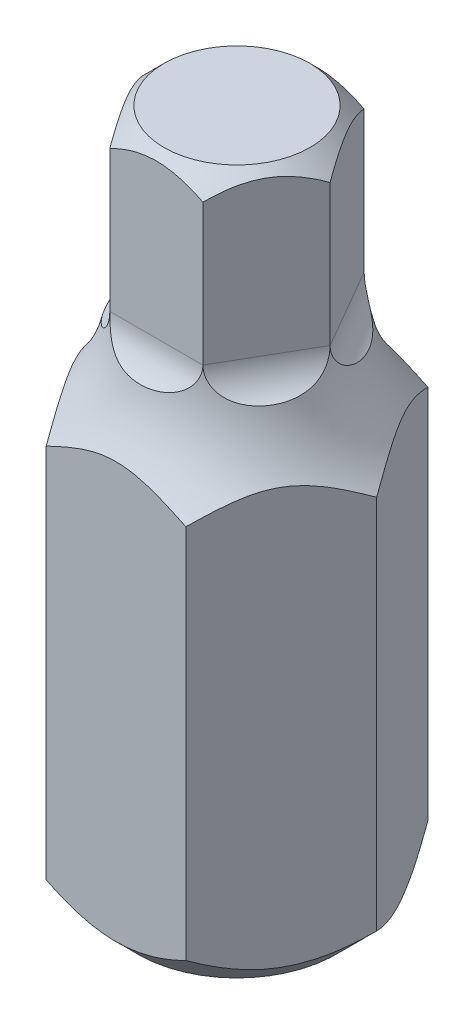
from build123d import *

# Parameters (mm, degrees)
BOSS_EXTRUDE1_DEPTH = 17
SKETCH2_OUTSIDE_W   = 12.79
SKETCH2_OUTSIDE_H   = 11.862
CUT_EXTRUDE1_DEPTH  = 5
FILLET4_R           = 1
SKETCH5_R           = 3.693225834


with BuildPart() as part:
    # Sketch1 → Boss-Extrude1 (new body)
    with BuildSketch(Plane(origin=(0, 0, 0), x_dir=(1, 0, 0), z_dir=(0, 1, 0))):
        Polygon((3.464101615, 0), (1.732050808, 3), (-1.732050808, 3), (-3.464101615, 0), (-1.732050808, -3), (1.732050808, -3), align=None)
    extrude(amount=-BOSS_EXTRUDE1_DEPTH)

    # Sketch2 outside → Cut-Extrude1 (cut)
    with BuildSketch(Plane(origin=(0, 0, 0), x_dir=(1, 0, 0), z_dir=(0, 1, 0))):
        Rectangle(SKETCH2_OUTSIDE_W, SKETCH2_OUTSIDE_H)
        Polygon((1.154700538, -2), (2.309401077, 0), (1.154700538, 2), (-1.154700538, 2), (-2.309401077, 0), (-1.154700538, -2), align=None, mode=Mode.SUBTRACT)
    extrude(amount=-CUT_EXTRUDE1_DEPTH, mode=Mode.SUBTRACT)

    # Fillet4
    fillet4_edges = [part.edges().sort_by_distance(p)[0] for p in [
        (-1.732050808, -5, 1),
        (0, -5, 2),
        (1.732050808, -5, 1),
        (1.732050808, -5, -1),
        (0, -5, -2),
        (-1.732050808, -5, -1),
    ]]
    fillet(fillet4_edges, radius=FILLET4_R - 0.0001)  # a hair under: the kernel refuses the full size

    # Sketch5 → Cut-Revolve3 (revolve, cut)
    with BuildSketch(Plane.XY, mode=Mode.PRIVATE) as cut_revolve3_sk:
        with Locations((6.00262691, -4)):
            Circle(SKETCH5_R)
    revolve(cut_revolve3_sk.sketch.rotate(Axis((0, -4, 0), (0, -1, 0)), 180), axis=Axis((0, -4, 0), (0, -1, 0)), mode=Mode.SUBTRACT)

    # Sketch7 → Cut-Revolve4 (revolve, cut)
    with BuildSketch(Plane.XY):
        Polygon((-1.809401077, 0), (-3.587101851, -1.777700775), (-1.809401077, 2.669648578), align=None)
        Polygon((-2.464101615, -17), (-2.464101615, -21.986189844), (-8.954218187, -10.509883428), align=None)
    revolve(axis=Axis((0, 0, 0), (0, -1, 0)), mode=Mode.SUBTRACT)


solid = part.part
